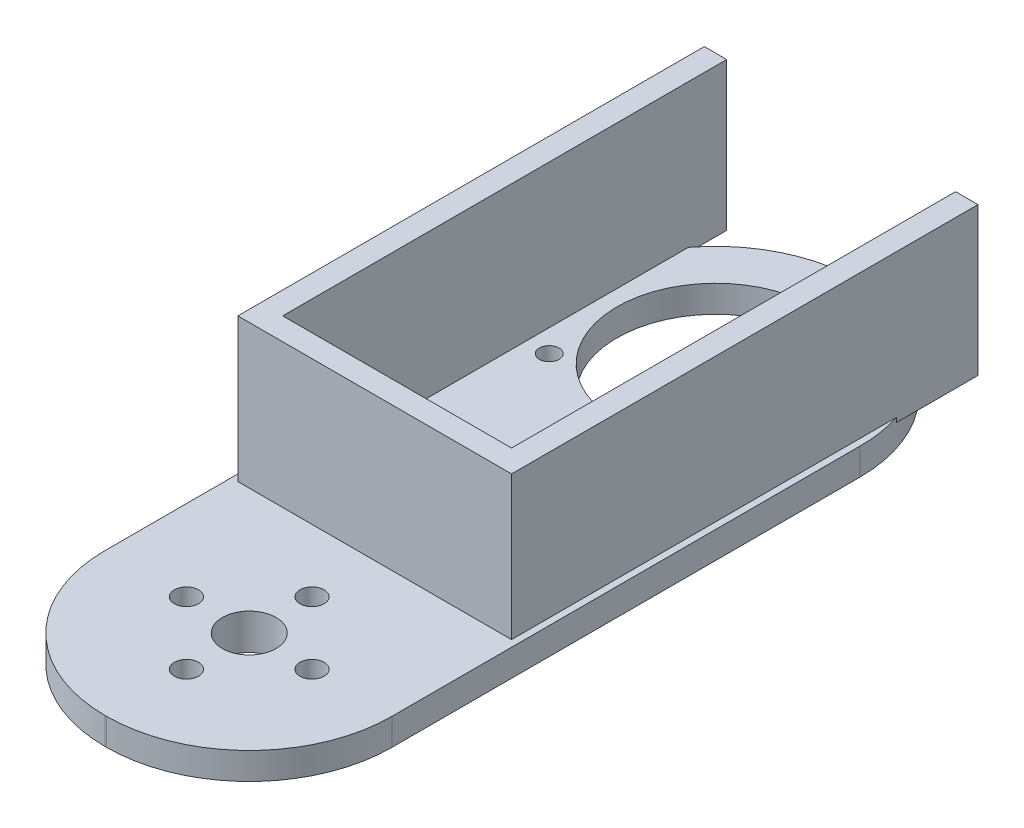
from build123d import *

# Parameters (mm, degrees)
S_CYL1_R      = 11
BOSS_1_DEPTH  = 1.1
BOSS_2_DEPTH  = 3
S_BOX3_W      = 2.5
S_BOX3_H      = 16.5
BOSS_3_DEPTH  = 52.01
S_BOX4_W      = 2.5
S_BOX4_H      = 16.5
BOSS_4_DEPTH  = 52.01
S_BOX5_W      = 30.52
S_BOX5_H      = 16.5
BOSS_5_DEPTH  = 2.5
S_HOLE6_R     = 3
HOLE_6_DEPTH  = 4.2
S_HOLE7_R     = 1.35
HOLE_7_DEPTH  = 4.2
S_HOLE8_R     = 1.35
HOLE_8_DEPTH  = 4.2
S_HOLE9_R     = 1.35
HOLE_9_DEPTH  = 4.2
S_HOLE10_R    = 1.35
HOLE_10_DEPTH = 4.2
S_HOLE11_R    = 11
HOLE_11_DEPTH = 3.2
S_HOLE12_R    = 1.1
HOLE_12_DEPTH = 3.2
S_HOLE13_R    = 1.1
HOLE_13_DEPTH = 3.2
S_HOLE14_R    = 1.1
HOLE_14_DEPTH = 3.2
S_HOLE15_R    = 1.1
HOLE_15_DEPTH = 3.2


with BuildPart() as part:
    # S_cyl1 → Boss_1 (new body)
    with BuildSketch(Plane(origin=(0, 0, 0), x_dir=(1, 0, 0), z_dir=(0, 1, 0))):
        Circle(S_CYL1_R)
    extrude(amount=BOSS_1_DEPTH)

    # S_prism2 → Boss_2 (add)
    with BuildSketch(Plane(origin=(0, 1, 0), x_dir=(1, 0, 0), z_dir=(0, 1, 0))):
        with BuildLine():
            Line((-0.1, -16), (0.1, -16))
            ThreePointArc((0.1, -16), (11.343, -11.343), (16, -0.1))
            Line((16, -0.1), (16, 52.1))
            ThreePointArc((16, 52.1), (11.343, 63.343), (0.1, 68))
            Line((0.1, 68), (-0.1, 68))
            ThreePointArc((-0.1, 68), (-11.343, 63.343), (-16, 52.1))
            Line((-16, 52.1), (-16, -0.1))
            ThreePointArc((-16, -0.1), (-11.343, -11.343), (-0.1, -16))
        make_face()
    extrude(amount=BOSS_2_DEPTH)

    # S_box3 → Boss_3 (add)
    with BuildSketch(Plane.XY.offset(-66)):
        with Locations((14.01, 11.75)):
            Rectangle(S_BOX3_W, S_BOX3_H)
    extrude(amount=BOSS_3_DEPTH)

    # S_box4 → Boss_4 (add)
    with BuildSketch(Plane.XY.offset(-66)):
        with Locations((-14.01, 11.75)):
            Rectangle(S_BOX4_W, S_BOX4_H)
    extrude(amount=BOSS_4_DEPTH)

    # S_box5 → Boss_5 (add)
    with BuildSketch(Plane.XY.offset(-16.49)):
        with Locations((0, 11.75)):
            Rectangle(S_BOX5_W, S_BOX5_H)
    extrude(amount=BOSS_5_DEPTH)

    # S_hole6 → Hole_6 (cut)
    with BuildSketch(Plane(origin=(0, -0.1, 0), x_dir=(1, 0, 0), z_dir=(0, 1, 0))):
        Circle(S_HOLE6_R)
    extrude(amount=HOLE_6_DEPTH, mode=Mode.SUBTRACT)

    # S_hole7 → Hole_7 (cut)
    with BuildSketch(Plane(origin=(0, -0.1, 0), x_dir=(1, 0, 0), z_dir=(0, 1, 0))):
        with Locations((7, 0)):
            Circle(S_HOLE7_R)
    extrude(amount=HOLE_7_DEPTH, mode=Mode.SUBTRACT)

    # S_hole8 → Hole_8 (cut)
    with BuildSketch(Plane(origin=(0, -0.1, 0), x_dir=(1, 0, 0), z_dir=(0, 1, 0))):
        with Locations((0, -7)):
            Circle(S_HOLE8_R)
    extrude(amount=HOLE_8_DEPTH, mode=Mode.SUBTRACT)

    # S_hole9 → Hole_9 (cut)
    with BuildSketch(Plane(origin=(0, -0.1, 0), x_dir=(1, 0, 0), z_dir=(0, 1, 0))):
        with Locations((-7, 0)):
            Circle(S_HOLE9_R)
    extrude(amount=HOLE_9_DEPTH, mode=Mode.SUBTRACT)

    # S_hole10 → Hole_10 (cut)
    with BuildSketch(Plane(origin=(0, -0.1, 0), x_dir=(1, 0, 0), z_dir=(0, 1, 0))):
        with Locations((0, 7)):
            Circle(S_HOLE10_R)
    extrude(amount=HOLE_10_DEPTH, mode=Mode.SUBTRACT)

    # S_hole11 → Hole_11 (cut)
    with BuildSketch(Plane(origin=(0, 0.9, 0), x_dir=(1, 0, 0), z_dir=(0, 1, 0))):
        with Locations((0, 52)):
            Circle(S_HOLE11_R)
    extrude(amount=HOLE_11_DEPTH, mode=Mode.SUBTRACT)

    # S_hole12 → Hole_12 (cut)
    with BuildSketch(Plane(origin=(0, 0.9, 0), x_dir=(1, 0, 0), z_dir=(0, 1, 0))):
        with Locations((-10.25, 43.7)):
            Circle(S_HOLE12_R)
    extrude(amount=HOLE_12_DEPTH, mode=Mode.SUBTRACT)

    # S_hole13 → Hole_13 (cut)
    with BuildSketch(Plane(origin=(0, 0.9, 0), x_dir=(1, 0, 0), z_dir=(0, 1, 0))):
        with Locations((10.25, 43.7)):
            Circle(S_HOLE13_R)
    extrude(amount=HOLE_13_DEPTH, mode=Mode.SUBTRACT)

    # S_hole14 → Hole_14 (cut)
    with BuildSketch(Plane(origin=(0, 0.9, 0), x_dir=(1, 0, 0), z_dir=(0, 1, 0))):
        with Locations((-10.25, 19.25)):
            Circle(S_HOLE14_R)
    extrude(amount=HOLE_14_DEPTH, mode=Mode.SUBTRACT)

    # S_hole15 → Hole_15 (cut)
    with BuildSketch(Plane(origin=(0, 0.9, 0), x_dir=(1, 0, 0), z_dir=(0, 1, 0))):
        with Locations((10.25, 19.25)):
            Circle(S_HOLE15_R)
    extrude(amount=HOLE_15_DEPTH, mode=Mode.SUBTRACT)


solid = part.part
